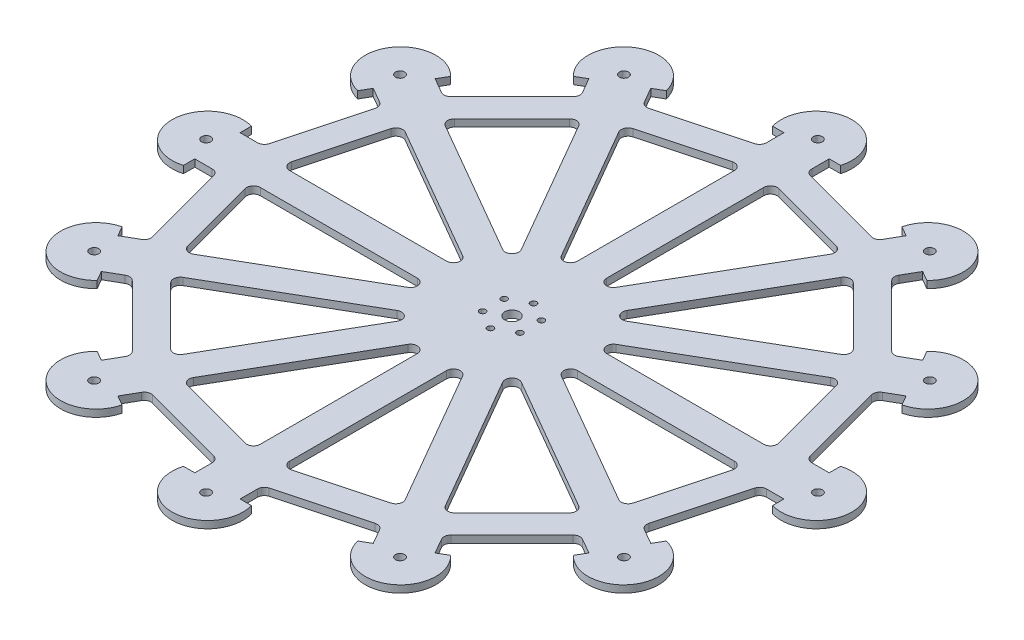
from build123d import *

# Parameters (mm, degrees)
BOSS_EXTRUDE1_DEPTH = 3.18
FILLET1_R           = 3
CIRPATTERN27_COUNT  = 12
SKETCH3_R           = 3.175
CUT_EXTRUDE1_DEPTH  = 213.155868172
SKETCH4_R           = 1.35
CUT_EXTRUDE2_DEPTH  = 213.155868172
SKETCH5_R           = 2
CUT_EXTRUDE3_DEPTH  = 213.155868172
CIRPATTERN28_COUNT  = 12


with BuildPart() as part:
    # Sketch1 → Boss-Extrude1 (new body)
    with BuildSketch(Plane(origin=(0, 0, 0), x_dir=(1, 0, 0), z_dir=(0, 1, 0))):
        with BuildLine():
            Line((0, 0), (0, 150))
            ThreePointArc((0, 150), (12.5, 143.75), (15, 130))
            Line((15, 130), (10, 130))
            Line((10, 130), (10, 120))
            Line((10, 120), (30.669872981, 114.461524227))
            Line((30.669872981, 114.461524227), (27.56404444, 102.870414312))
            Line((27.56404444, 102.870414312), (6.470476128, 108.522418906))
            Line((6.470476128, 108.522418906), (6.470476128, 24.148145657))
            Line((6.470476128, 24.148145657), (0, 0))
        make_face()
    boss_extrude1 = extrude(amount=BOSS_EXTRUDE1_DEPTH)

    # Mirror1: Boss-Extrude1 across plane
    add(boss_extrude1.mirror(Plane(origin=(30.669872981, 3.18, -114.461524227), x_dir=(-0.2588190451025218, 0, 0.965925826289068), z_dir=(-0.9659258262890681, 0, -0.2588190451025218))))

    # Fillet1
    fillet1_edges = [part.edges().sort_by_distance(p)[0] for p in [
        (6.470476128, 1.59, -24.148145657),
        (48.657612752, 1.59, -97.218409717),
        (6.470476128, 1.59, -108.522418906),
        (51.339745962, 1.59, -108.923048454),
        (10, 1.59, -120),
    ]]
    fillet(fillet1_edges, radius=FILLET1_R)


with BuildPart() as cirpattern27_1:
    # CirPattern27: pattern copy
    add(part.part.rotate(Axis((0, 3.18, 0), (0, -1, 0)), 1 * 360 / CIRPATTERN27_COUNT))


with BuildPart() as cirpattern27_2:
    # CirPattern27: pattern copy
    add(part.part.rotate(Axis((0, 3.18, 0), (0, -1, 0)), 2 * 360 / CIRPATTERN27_COUNT))


with BuildPart() as cirpattern27_3:
    # CirPattern27: pattern copy
    add(part.part.rotate(Axis((0, 3.18, 0), (0, -1, 0)), 3 * 360 / CIRPATTERN27_COUNT))


with BuildPart() as cirpattern27_4:
    # CirPattern27: pattern copy
    add(part.part.rotate(Axis((0, 3.18, 0), (0, -1, 0)), 4 * 360 / CIRPATTERN27_COUNT))


with BuildPart() as cirpattern27_5:
    # CirPattern27: pattern copy
    add(part.part.rotate(Axis((0, 3.18, 0), (0, -1, 0)), 5 * 360 / CIRPATTERN27_COUNT))


with BuildPart() as cirpattern27_6:
    # CirPattern27: pattern copy
    add(part.part.rotate(Axis((0, 3.18, 0), (0, -1, 0)), 6 * 360 / CIRPATTERN27_COUNT))


with BuildPart() as cirpattern27_7:
    # CirPattern27: pattern copy
    add(part.part.rotate(Axis((0, 3.18, 0), (0, -1, 0)), 7 * 360 / CIRPATTERN27_COUNT))


with BuildPart() as cirpattern27_8:
    # CirPattern27: pattern copy
    add(part.part.rotate(Axis((0, 3.18, 0), (0, -1, 0)), 8 * 360 / CIRPATTERN27_COUNT))


with BuildPart() as cirpattern27_9:
    # CirPattern27: pattern copy
    add(part.part.rotate(Axis((0, 3.18, 0), (0, -1, 0)), 9 * 360 / CIRPATTERN27_COUNT))


with BuildPart() as cirpattern27_10:
    # CirPattern27: pattern copy
    add(part.part.rotate(Axis((0, 3.18, 0), (0, -1, 0)), 10 * 360 / CIRPATTERN27_COUNT))


with BuildPart() as cirpattern27_11:
    # CirPattern27: pattern copy
    add(part.part.rotate(Axis((0, 3.18, 0), (0, -1, 0)), 11 * 360 / CIRPATTERN27_COUNT))


with BuildPart() as cirpattern27_8_1:
    add(cirpattern27_8.part)

    # Combine1: union CirPattern27_9, CirPattern27_10, CirPattern27_11, part, CirPattern27_1, CirPattern27_2, CirPattern27_3, CirPattern27_4, CirPattern27_5, CirPattern27_6, CirPattern27_7
    add(cirpattern27_9.part)
    add(cirpattern27_10.part)
    add(cirpattern27_11.part)
    add(part.part)
    add(cirpattern27_1.part)
    add(cirpattern27_2.part)
    add(cirpattern27_3.part)
    add(cirpattern27_4.part)
    add(cirpattern27_5.part)
    add(cirpattern27_6.part)
    add(cirpattern27_7.part)

    # Sketch3 → Cut-Extrude1 (cut, through all)
    with BuildSketch(Plane(origin=(0, 3.18, 0), x_dir=(1, 0, 0), z_dir=(0, 1, 0))):
        Circle(SKETCH3_R)
    extrude(amount=-CUT_EXTRUDE1_DEPTH, mode=Mode.SUBTRACT)

    # Sketch4 → Cut-Extrude2 (cut, through all)
    with BuildSketch(Plane(origin=(0, 3.18, 0), x_dir=(1, 0, 0), z_dir=(0, 1, 0))):
        with Locations((0, 9.5)):
            Circle(SKETCH4_R)
        with Locations((8.227241336, 4.75)):
            Circle(SKETCH4_R)
        with Locations((8.227241336, -4.75)):
            Circle(SKETCH4_R)
        with Locations((0, -9.5)):
            Circle(SKETCH4_R)
        with Locations((-8.227241336, -4.75)):
            Circle(SKETCH4_R)
        with Locations((-8.227241336, 4.75)):
            Circle(SKETCH4_R)
    extrude(amount=-CUT_EXTRUDE2_DEPTH, mode=Mode.SUBTRACT)

    # Sketch5 → Cut-Extrude3 (cut, through all)
    with BuildSketch(Plane(origin=(0, 3.18, 0), x_dir=(1, 0, 0), z_dir=(0, 1, 0))):
        with Locations((0, 135)):
            Circle(SKETCH5_R)
    cut_extrude3 = extrude(amount=-CUT_EXTRUDE3_DEPTH, mode=Mode.SUBTRACT)

    # CirPattern28: Cut-Extrude3 ×12 about axis
    cirpattern28_axis = Axis((0, 3.18, 0), (0, -1, 0))
    for i in range(1, CIRPATTERN28_COUNT):
        add(cut_extrude3.rotate(cirpattern28_axis, i * 360 / CIRPATTERN28_COUNT), mode=Mode.SUBTRACT)


solid = cirpattern27_8_1.part
